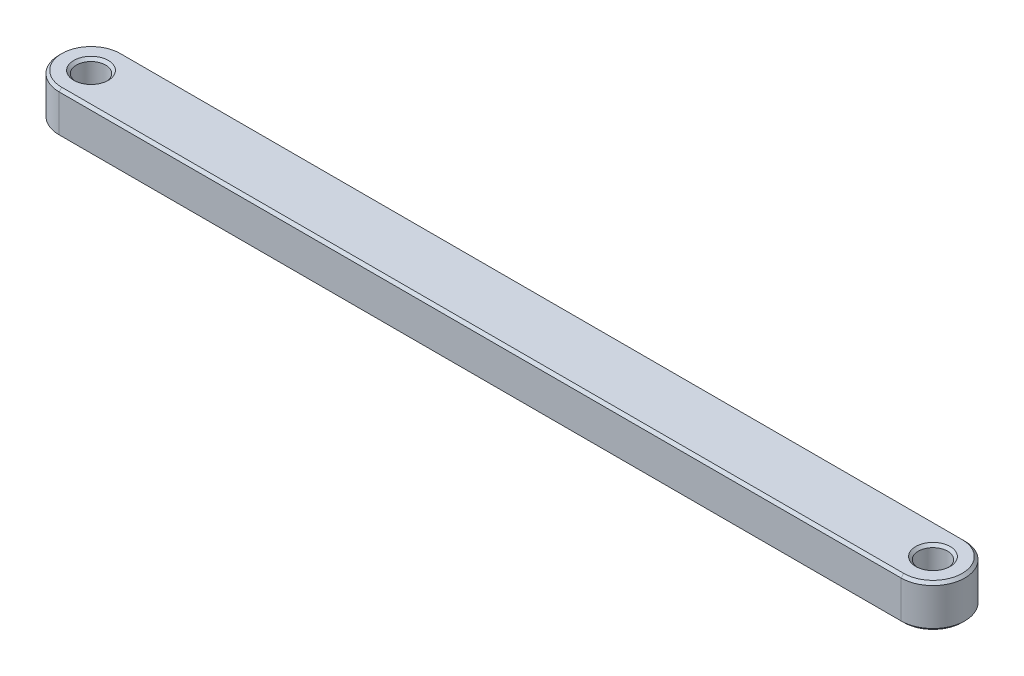
from build123d import *

# Parameters (mm, degrees)
SKETCH1_R           = 2.1828125
BOSS_EXTRUDE1_DEPTH = 6.35
CHAMFER1_SIZE       = 0.396875


with BuildPart() as part:
    # Sketch1 → Boss-Extrude1 (new body)
    with BuildSketch(Plane(origin=(0, 0, 0), x_dir=(1, 0, 0), z_dir=(0, 1, 0))):
        with BuildLine():
            Line((0, 4.7625), (125.72238, 4.7625))
            ThreePointArc((125.72238, 4.7625), (130.48488, 0), (125.72238, -4.7625))
            Line((125.72238, -4.7625), (0, -4.7625))
            ThreePointArc((0, -4.7625), (-4.7625, 0), (0, 4.7625))
        make_face()
        Circle(SKETCH1_R, mode=Mode.SUBTRACT)
        with Locations((125.72238, 0)):
            Circle(SKETCH1_R, mode=Mode.SUBTRACT)
    extrude(amount=BOSS_EXTRUDE1_DEPTH)

    # Chamfer1
    chamfer1_edges = [part.edges().sort_by_distance(p)[0] for p in [
        (123.5395675, 0, 0),
        (-2.1828125, 0, 0),
        (62.86119, 0, 4.7625),
        (130.48488, 0, 0),
        (62.86119, 0, -4.7625),
        (-4.7625, 0, 0),
        (123.5395675, 6.35, 0),
        (62.86119, 6.35, -4.7625),
        (130.48488, 6.35, 0),
        (62.86119, 6.35, 4.7625),
        (-4.7625, 6.35, 0),
        (-2.1828125, 6.35, 0),
    ]]
    chamfer(chamfer1_edges, length=CHAMFER1_SIZE)


solid = part.part
